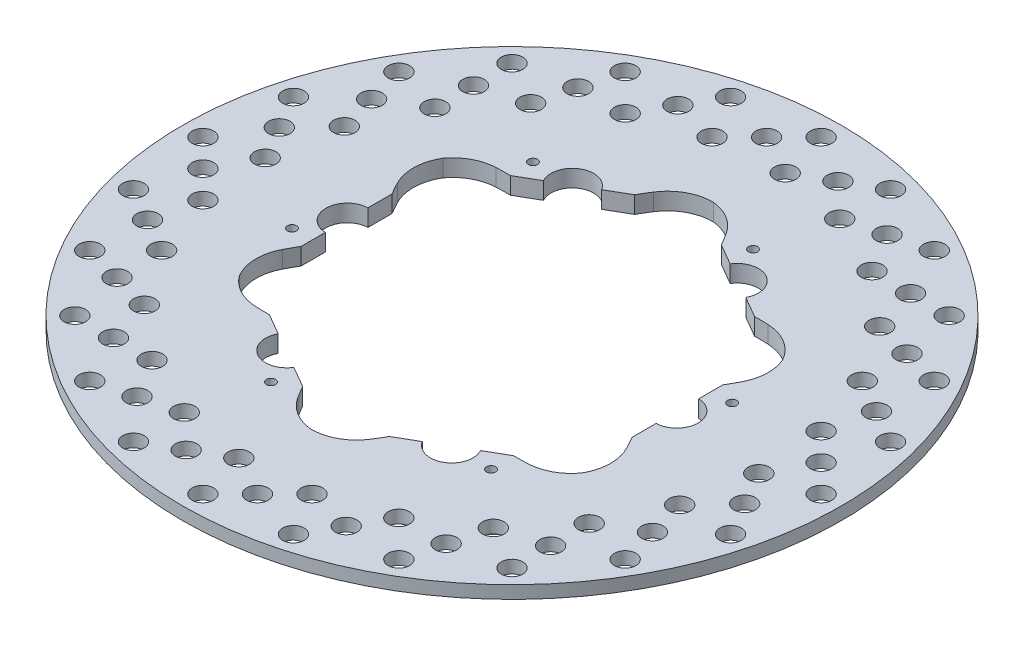
from build123d import *

# Parameters (mm, degrees)
SKETCH1_R               = 92.075
SKETCH1_R_2             = 55.5625
BOSS_EXTRUDE2_DEPTH     = 2.38125
SKETCH2_R               = 3
CUT_EXTRUDE1_DEPTH      = 131.30077765
BOSS_EXTRUDE3_DEPTH     = 2.38125
FILLET1_R               = 12.7
CIRPATTERN1_START       = -2.38125
CIRPATTERN1_DEPTH       = 4.7625
CUT_EXTRUDE2_START      = -1.190625
SKETCH4_R               = 92.075
SKETCH4_R_2             = 68.2625
CUT_EXTRUDE2_DEPTH      = 1.190625
CUT_EXTRUDE3_DEPTH      = 131.300777795
CUT_EXTRUDE3_DEPTH_BACK = 131.300777795
SKETCH6_R               = 1.27


# Read off the part's stored shape, not the designer's step: CirPattern1
with BuildPart() as part:
    # Sketch1 → Boss-Extrude2 (new, symmetric)
    with BuildSketch(Plane(origin=(0, 0, 0), x_dir=(1, 0, 0), z_dir=(0, 1, 0))):
        with Locations(Location((0, 0, 0), (0, 0, 90))):
            Circle(SKETCH1_R)
        with Locations(Location((0, 0, 0), (0, 0, 90))):
            Circle(SKETCH1_R_2, mode=Mode.SUBTRACT)
    extrude(amount=BOSS_EXTRUDE2_DEPTH, both=True)

    # Sketch2 → Cut-Extrude1 (cut, through all)
    with BuildSketch(Plane.XZ.offset(2.38125)):
        with Locations(Location((0, 86.36, 0), (0, 0, 270))):
            Circle(SKETCH2_R)
        with Locations(Location((7.62, 78.74, 0), (0, 0, 270))):
            Circle(SKETCH2_R)
        with Locations(Location((15.24, 71.12, 0), (0, 0, 270))):
            Circle(SKETCH2_R)
        with Locations(Location((27.739766408, 74.084798438, 0), (0, 0, 270))):
            Circle(SKETCH2_R)
        with Locations(Location((33.12792008, 64.752242518, 0), (0, 0, 270))):
            Circle(SKETCH2_R)
        with Locations(Location((22.351612735, 83.417354358, 0), (0, 0, 270))):
            Circle(SKETCH2_R)
        with Locations(Location((45.969113577, 64.380840294, 0), (0, 0, 270))):
            Circle(SKETCH2_R)
        with Locations(Location((48.758227154, 53.971726717, 0), (0, 0, 270))):
            Circle(SKETCH2_R)
        with Locations(Location((43.18, 74.789953871, 0), (0, 0, 270))):
            Circle(SKETCH2_R)
        with Locations(Location((61.065741623, 50.289434278, 0), (0, 0, 270))):
            Circle(SKETCH2_R)
        with Locations(Location((61.065741623, 39.513126933, 0), (0, 0, 270))):
            Circle(SKETCH2_R)
        with Locations(Location((61.065741623, 61.065741623, 0), (0, 0, 270))):
            Circle(SKETCH2_R)
        with Locations(Location((72.000840294, 32.770886423, 0), (0, 0, 270))):
            Circle(SKETCH2_R)
        with Locations(Location((69.211726717, 22.361772846, 0), (0, 0, 270))):
            Circle(SKETCH2_R)
        with Locations(Location((74.789953871, 43.18, 0), (0, 0, 270))):
            Circle(SKETCH2_R)
        with Locations(Location((78.029200686, 13.019056815, 0), (0, 0, 270))):
            Circle(SKETCH2_R)
        with Locations(Location((72.641047013, 3.686500895, 0), (0, 0, 270))):
            Circle(SKETCH2_R)
        with Locations(Location((83.417354358, 22.351612735, 0), (0, 0, 270))):
            Circle(SKETCH2_R)
        with Locations(Location((78.74, -7.62, 0), (0, 0, 270))):
            Circle(SKETCH2_R)
        with Locations(Location((71.12, -15.24, 0), (0, 0, 270))):
            Circle(SKETCH2_R)
        with Locations(Location((86.36, 0, 0), (0, 0, 270))):
            Circle(SKETCH2_R)
        with Locations(Location((74.084798438, -27.739766408, 0), (0, 0, 270))):
            Circle(SKETCH2_R)
        with Locations(Location((64.752242518, -33.12792008, 0), (0, 0, 270))):
            Circle(SKETCH2_R)
        with Locations(Location((83.417354358, -22.351612735, 0), (0, 0, 270))):
            Circle(SKETCH2_R)
        with Locations(Location((64.380840294, -45.969113577, 0), (0, 0, 270))):
            Circle(SKETCH2_R)
        with Locations(Location((53.971726717, -48.758227154, 0), (0, 0, 270))):
            Circle(SKETCH2_R)
        with Locations(Location((74.789953871, -43.18, 0), (0, 0, 270))):
            Circle(SKETCH2_R)
        with Locations(Location((50.289434278, -61.065741623, 0), (0, 0, 270))):
            Circle(SKETCH2_R)
        with Locations(Location((39.513126933, -61.065741623, 0), (0, 0, 270))):
            Circle(SKETCH2_R)
        with Locations(Location((61.065741623, -61.065741623, 0), (0, 0, 270))):
            Circle(SKETCH2_R)
        with Locations(Location((32.770886423, -72.000840294, 0), (0, 0, 270))):
            Circle(SKETCH2_R)
        with Locations(Location((22.361772846, -69.211726717, 0), (0, 0, 270))):
            Circle(SKETCH2_R)
        with Locations(Location((43.18, -74.789953871, 0), (0, 0, 270))):
            Circle(SKETCH2_R)
        with Locations(Location((13.019056815, -78.029200686, 0), (0, 0, 270))):
            Circle(SKETCH2_R)
        with Locations(Location((3.686500895, -72.641047013, 0), (0, 0, 270))):
            Circle(SKETCH2_R)
        with Locations(Location((22.351612735, -83.417354358, 0), (0, 0, 270))):
            Circle(SKETCH2_R)
        with Locations(Location((-7.62, -78.74, 0), (0, 0, 270))):
            Circle(SKETCH2_R)
        with Locations(Location((-15.24, -71.12, 0), (0, 0, 270))):
            Circle(SKETCH2_R)
        with Locations(Location((0, -86.36, 0), (0, 0, 270))):
            Circle(SKETCH2_R)
        with Locations(Location((-27.739766408, -74.084798438, 0), (0, 0, 270))):
            Circle(SKETCH2_R)
        with Locations(Location((-33.12792008, -64.752242518, 0), (0, 0, 270))):
            Circle(SKETCH2_R)
        with Locations(Location((-22.351612735, -83.417354358, 0), (0, 0, 270))):
            Circle(SKETCH2_R)
        with Locations(Location((-45.969113577, -64.380840294, 0), (0, 0, 270))):
            Circle(SKETCH2_R)
        with Locations(Location((-48.758227154, -53.971726717, 0), (0, 0, 270))):
            Circle(SKETCH2_R)
        with Locations(Location((-43.18, -74.789953871, 0), (0, 0, 270))):
            Circle(SKETCH2_R)
        with Locations(Location((-61.065741623, -50.289434278, 0), (0, 0, 270))):
            Circle(SKETCH2_R)
        with Locations(Location((-61.065741623, -39.513126933, 0), (0, 0, 270))):
            Circle(SKETCH2_R)
        with Locations(Location((-61.065741623, -61.065741623, 0), (0, 0, 270))):
            Circle(SKETCH2_R)
        with Locations(Location((-72.000840294, -32.770886423, 0), (0, 0, 270))):
            Circle(SKETCH2_R)
        with Locations(Location((-69.211726717, -22.361772846, 0), (0, 0, 270))):
            Circle(SKETCH2_R)
        with Locations(Location((-74.789953871, -43.18, 0), (0, 0, 270))):
            Circle(SKETCH2_R)
        with Locations(Location((-78.029200686, -13.019056815, 0), (0, 0, 270))):
            Circle(SKETCH2_R)
        with Locations(Location((-72.641047013, -3.686500895, 0), (0, 0, 270))):
            Circle(SKETCH2_R)
        with Locations(Location((-83.417354358, -22.351612735, 0), (0, 0, 270))):
            Circle(SKETCH2_R)
        with Locations(Location((-78.74, 7.62, 0), (0, 0, 270))):
            Circle(SKETCH2_R)
        with Locations(Location((-71.12, 15.24, 0), (0, 0, 270))):
            Circle(SKETCH2_R)
        with Locations(Location((-86.36, 0, 0), (0, 0, 270))):
            Circle(SKETCH2_R)
        with Locations(Location((-74.084798438, 27.739766408, 0), (0, 0, 270))):
            Circle(SKETCH2_R)
        with Locations(Location((-64.752242518, 33.12792008, 0), (0, 0, 270))):
            Circle(SKETCH2_R)
        with Locations(Location((-83.417354358, 22.351612735, 0), (0, 0, 270))):
            Circle(SKETCH2_R)
        with Locations(Location((-64.380840294, 45.969113577, 0), (0, 0, 270))):
            Circle(SKETCH2_R)
        with Locations(Location((-53.971726717, 48.758227154, 0), (0, 0, 270))):
            Circle(SKETCH2_R)
        with Locations(Location((-74.789953871, 43.18, 0), (0, 0, 270))):
            Circle(SKETCH2_R)
        with Locations(Location((-50.289434278, 61.065741623, 0), (0, 0, 270))):
            Circle(SKETCH2_R)
        with Locations(Location((-39.513126933, 61.065741623, 0), (0, 0, 270))):
            Circle(SKETCH2_R)
        with Locations(Location((-61.065741623, 61.065741623, 0), (0, 0, 270))):
            Circle(SKETCH2_R)
        with Locations(Location((-32.770886423, 72.000840294, 0), (0, 0, 270))):
            Circle(SKETCH2_R)
        with Locations(Location((-22.361772846, 69.211726717, 0), (0, 0, 270))):
            Circle(SKETCH2_R)
        with Locations(Location((-43.18, 74.789953871, 0), (0, 0, 270))):
            Circle(SKETCH2_R)
        with Locations(Location((-13.019056815, 78.029200686, 0), (0, 0, 270))):
            Circle(SKETCH2_R)
        with Locations(Location((-3.686500895, 72.641047013, 0), (0, 0, 270))):
            Circle(SKETCH2_R)
        with Locations(Location((-22.351612735, 83.417354358, 0), (0, 0, 270))):
            Circle(SKETCH2_R)
    extrude(amount=-CUT_EXTRUDE1_DEPTH, mode=Mode.SUBTRACT)

    # Sketch3 → Boss-Extrude3 (add, symmetric)
    with BuildSketch(Plane(origin=(0, 0, 0), x_dir=(1, 0, 0), z_dir=(0, 1, 0))):
        with BuildLine():
            Line((-46.2153, 5.950469261), (-46.2153, 12.7))
            ThreePointArc((-46.2153, 12.7), (-48.74771338, 17.374444913), (-50.92387241, 22.225))
            ThreePointArc((-50.92387241, 22.225), (-55.5625, 0), (-50.92387241, -22.225))
            ThreePointArc((-50.92387241, -22.225), (-48.74771338, -17.374444913), (-46.2153, -12.7))
            Line((-46.2153, -12.7), (-46.2153, -5.950469261))
            ThreePointArc((-46.2153, -5.950469261), (-51.990625, 0), (-46.2153, 5.950469261))
        make_face()
    extrude(amount=BOSS_EXTRUDE3_DEPTH, both=True)

    # Fillet1
    fillet1_edges = [part.edges().sort_by_distance(p)[0] for p in [
        (-50.92387241, 0, -22.225),
        (-50.92387241, 0, 22.225),
    ]]
    fillet(fillet1_edges, radius=FILLET1_R)

    # CirPattern1 outline → CirPattern1 (add)
    with BuildSketch(Plane(origin=(0, 0, 0), x_dir=(1, 0, 0), z_dir=(0, 1, 0)).offset(CIRPATTERN1_START)):
        with BuildLine():
            Line((-34.106172628, 33.673623844), (-28.260907544, 37.048389213))
            ThreePointArc((-28.260907544, 37.048389213), (-25.9953125, 45.025202009), (-17.954392456, 42.998858474))
            Line((-17.954392456, 42.998858474), (-12.109127372, 46.373623844))
            ThreePointArc((-12.109127372, 46.373623844), (-11.13754759, 48.043676571), (-10.120960404, 49.68672066))
            ThreePointArc((-10.120960404, 49.68672066), (-5.442554633, 54.035768488), (0.761209038, 55.557285454))
            ThreePointArc((0.761209038, 55.557285454), (-27.119416363, 48.494625087), (-47.73341605, 28.437869091))
            ThreePointArc((-47.73341605, 28.437869091), (-43.491476124, 32.114561986), (-38.078961632, 33.603458174))
            ThreePointArc((-38.078961632, 33.603458174), (-36.093057237, 33.666290929), (-34.106172628, 33.673623844))
        make_face()
        with BuildLine():
            ThreePointArc((-47.73341605, -28.437869091), (-27.78125, -48.118536498), (-0.761209038, -55.557285454))
            ThreePointArc((-0.761209038, -55.557285454), (-6.06628845, -53.722004164), (-10.061967618, -49.77907721))
            ThreePointArc((-10.061967618, -49.77907721), (-11.109334577, -48.090649932), (-12.109127372, -46.373623844))
            Line((-12.109127372, -46.373623844), (-17.954392456, -42.998858474))
            ThreePointArc((-17.954392456, -42.998858474), (-25.9953125, -45.025202009), (-28.260907544, -37.048389213))
            Line((-28.260907544, -37.048389213), (-34.106172628, -33.673623844))
            ThreePointArc((-34.106172628, -33.673623844), (-36.093057237, -33.666290929), (-38.078961632, -33.603458174))
            ThreePointArc((-38.078961632, -33.603458174), (-43.491476124, -32.114561986), (-47.73341605, -28.437869091))
        make_face()
        with BuildLine():
            ThreePointArc((-0.761209038, -55.557285454), (27.119416363, -48.494625088), (47.73341605, -28.437869091))
            ThreePointArc((47.73341605, -28.437869091), (43.491476124, -32.114561986), (38.078961632, -33.603458174))
            ThreePointArc((38.078961632, -33.603458174), (36.093057237, -33.666290929), (34.106172628, -33.673623844))
            Line((34.106172628, -33.673623844), (28.260907544, -37.048389213))
            ThreePointArc((28.260907544, -37.048389213), (25.9953125, -45.025202009), (17.954392456, -42.998858474))
            Line((17.954392456, -42.998858474), (12.109127372, -46.373623844))
            ThreePointArc((12.109127372, -46.373623844), (11.13754759, -48.043676571), (10.120960404, -49.68672066))
            ThreePointArc((10.120960404, -49.68672066), (5.442554633, -54.035768488), (-0.761209038, -55.557285454))
        make_face()
        with BuildLine():
            ThreePointArc((47.73341605, -28.437869091), (55.557285454, -0.761209038), (48.494625088, 27.119416363))
            ThreePointArc((48.494625088, 27.119416363), (49.557764573, 21.607442178), (48.140929249, 16.175619036))
            ThreePointArc((48.140929249, 16.175619036), (47.202391814, 14.424359003), (46.2153, 12.7))
            Line((46.2153, 12.7), (46.2153, 5.950469261))
            ThreePointArc((46.2153, 5.950469261), (51.990625, 0), (46.2153, -5.950469261))
            Line((46.2153, -5.950469261), (46.2153, -12.7))
            ThreePointArc((46.2153, -12.7), (47.175818197, -14.376439137), (48.090442525, -16.07835151))
            ThreePointArc((48.090442525, -16.07835151), (49.51762554, -22.30449367), (47.73341605, -28.437869091))
        make_face()
        with BuildLine():
            ThreePointArc((48.494625088, 27.119416363), (28.437869092, 47.73341605), (0.761209038, 55.557285454))
            ThreePointArc((0.761209038, 55.557285454), (6.06628845, 53.722004164), (10.061967618, 49.77907721))
            ThreePointArc((10.061967618, 49.77907721), (11.109334577, 48.090649932), (12.109127372, 46.373623844))
            Line((12.109127372, 46.373623844), (17.954392456, 42.998858474))
            ThreePointArc((17.954392456, 42.998858474), (25.9953125, 45.025202009), (28.260907544, 37.048389213))
            Line((28.260907544, 37.048389213), (34.106172628, 33.673623844))
            ThreePointArc((34.106172628, 33.673623844), (36.038270607, 33.667237435), (37.969482121, 33.60836915))
            ThreePointArc((37.969482121, 33.60836915), (44.075070907, 31.731274817), (48.494625088, 27.119416363))
        make_face()
    extrude(amount=CIRPATTERN1_DEPTH)

    # Sketch4 → Cut-Extrude2 (cut)
    with BuildSketch(Plane.XZ.offset(2.38125).offset(CUT_EXTRUDE2_START)):
        with Locations(Location((0, 0, 0), (0, 0, 270))):
            Circle(SKETCH4_R)
        with Locations(Location((0, 0, 0), (0, 0, 270))):
            Circle(SKETCH4_R_2, mode=Mode.SUBTRACT)
    extrude(amount=CUT_EXTRUDE2_DEPTH, mode=Mode.SUBTRACT)

    # Sketch6 → Cut-Extrude3 (cut, two sides: drawn at the far end of the back side and taken through both)
    with BuildSketch(Plane(origin=(0, 2.38125, 0), x_dir=(1, 0, 0), z_dir=(0, 1, 0)).offset(-CUT_EXTRUDE3_DEPTH_BACK)):
        with Locations(Location((-17.609679143, -49.728199843, 0), (0, 0, 270))):
            Circle(SKETCH6_R)
        with Locations(Location((-51.87072392, -9.613670431, 0), (0, 0, 270))):
            Circle(SKETCH6_R)
        with Locations(Location((-34.261044777, 40.114529412, 0), (0, 0, 270))):
            Circle(SKETCH6_R)
        with Locations(Location((17.609679143, 49.728199843, 0), (0, 0, 270))):
            Circle(SKETCH6_R)
        with Locations(Location((51.87072392, 9.613670431, 0), (0, 0, 270))):
            Circle(SKETCH6_R)
        with Locations(Location((34.261044777, -40.114529412, 0), (0, 0, 270))):
            Circle(SKETCH6_R)
    extrude(amount=CUT_EXTRUDE3_DEPTH + CUT_EXTRUDE3_DEPTH_BACK, mode=Mode.SUBTRACT)


solid = part.part
